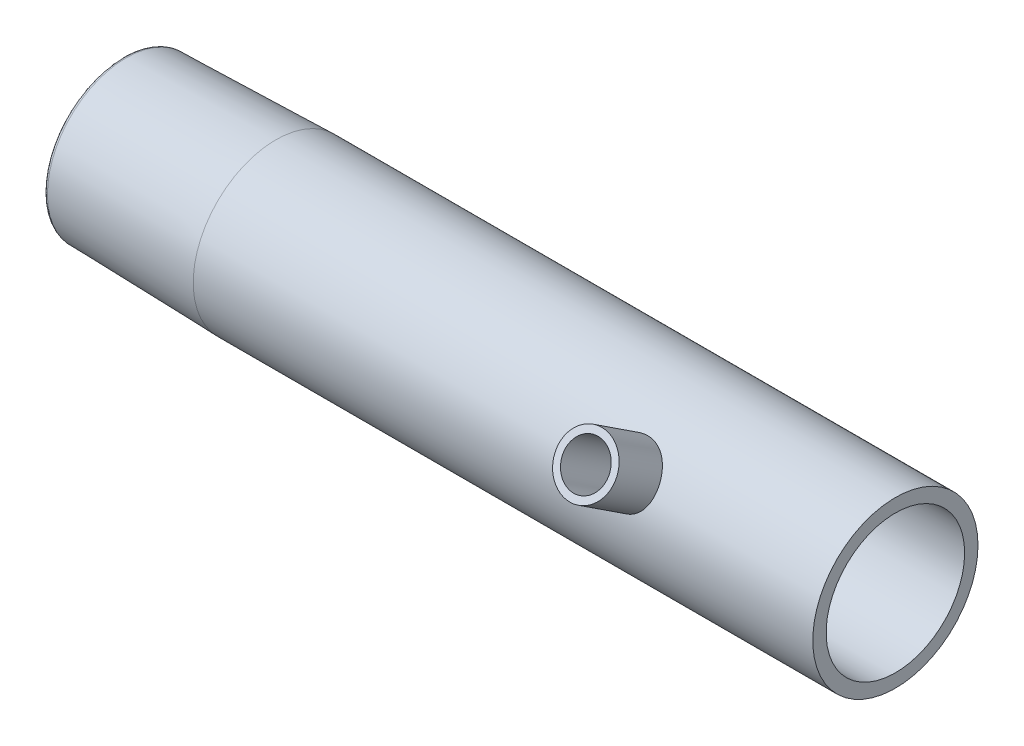
from build123d import *

# Parameters (mm, degrees)
BOSS_EXTRUDE1_START = -21
SKETCH2_R           = 10.322343774
SKETCH2_R_2         = 9.5
BOSS_EXTRUDE1_DEPTH = 21
FILLET1_R           = 0.5
SKETCH3_R           = 11.335
SKETCH3_R_2         = 9.5
BOSS_EXTRUDE2_DEPTH = 85
BOSS_EXTRUDE3_START = 9.334999999
BOSS_EXTRUDE3_DEPTH = 8.999999999
SKETCH5_R           = 3.050000003
CUT_EXTRUDE1_DEPTH  = 11


# Read off the part's stored shape, not the designer's step: Boss-Extrude3
with BuildPart() as part:
    # Sketch1 → Revolve1 (revolve)
    with BuildSketch(Plane.XY, mode=Mode.PRIVATE) as revolve1_sk:
        with BuildLine():
            Line((6, 11.335), (-14.512496096, 10.822187598))
            ThreePointArc((-14.512496096, 10.822187598), (-14.857944163, 10.671451174), (-15, 10.322343774))
            Line((-15, 10.322343774), (6, 10.322343774))
            Line((6, 10.322343774), (6, 11.335))
        make_face()
    revolve(revolve1_sk.sketch.rotate(Axis((-15.624243475, 0, 0), (1, 0, 0)), 90), axis=Axis((-15.624243475, 0, 0), (1, 0, 0)))

    # Sketch2 → Boss-Extrude1 (add)
    with BuildSketch(Plane(origin=(6, 0, 0), x_dir=(0, 0, -1), z_dir=(1, 0, 0)).offset(BOSS_EXTRUDE1_START)):
        Circle(SKETCH2_R)
        Circle(SKETCH2_R_2, mode=Mode.SUBTRACT)
    extrude(amount=BOSS_EXTRUDE1_DEPTH)

    # Fillet1
    fillet1_edges = [part.edges().sort_by_distance(p)[0] for p in [
        (-15, 0, 9.5),
    ]]
    fillet(fillet1_edges, radius=FILLET1_R)

    # Sketch3 → Boss-Extrude2 (add)
    with BuildSketch(Plane(origin=(6, 0, 0), x_dir=(0, 0, -1), z_dir=(1, 0, 0))):
        Circle(SKETCH3_R)
        Circle(SKETCH3_R_2, mode=Mode.SUBTRACT)
    extrude(amount=BOSS_EXTRUDE2_DEPTH)

    # Boss-Extrude3 outline → Boss-Extrude3 (add)
    with BuildSketch(Plane(origin=(0, 0, 0), x_dir=(1, 0, 0), z_dir=(0, 0.5487408887134131, 0.8359924862425581)).offset(BOSS_EXTRUDE3_START)):
        with BuildLine():
            ThreePointArc((60.34828113, -1.762888304), (68.110256528, -1.132677071), (60.881070562, 1.762888255))
            ThreePointArc((60.881070562, 1.762888255), (60.200061526, 0.062653443), (60.34828113, -1.762888304))
        make_face()
    extrude(amount=BOSS_EXTRUDE3_DEPTH)

    # Sketch5 → Cut-Extrude1 (cut)
    with BuildSketch(Plane(origin=(0, 10.061164202, 15.32792223), x_dir=(1, 0, 0), z_dir=(1.7486012637846212e-15, 0.5487408891490924, 0.8359924859565806))):
        with Locations(Location((64.155159027, -0.535011823, 0), (0, 0, 270))):
            Circle(SKETCH5_R)
    extrude(amount=-CUT_EXTRUDE1_DEPTH, mode=Mode.SUBTRACT)


solid = part.part
